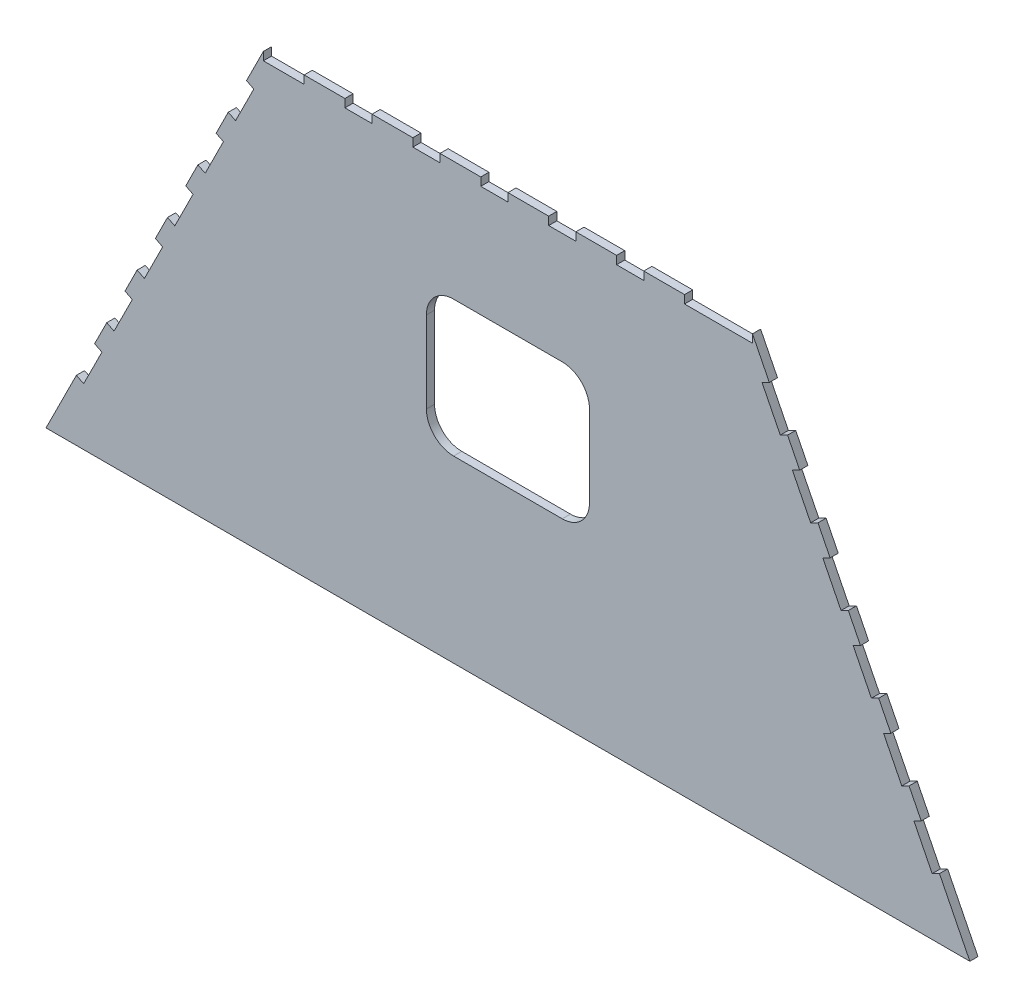
from build123d import *

# Parameters (mm, degrees)
BOSS_EXTRUDE1_DEPTH = 3
CUT_EXTRUDE1_DEPTH  = 10
LPATTERN1_COUNT     = 6
LPATTERN1_PITCH     = 25
CUT_EXTRUDE2_DEPTH  = 10
LPATTERN2_COUNT     = 6
LPATTERN2_PITCH     = 25
CAVITY1_START       = 77
CAVITY1_OUTLINE_W   = 15
CAVITY1_OUTLINE_H   = 3
CAVITY1_OUTLINE_W_2 = 10
CAVITY1_OUTLINE_W_3 = 25
CAVITY1_DEPTH       = 3
SKETCH5_W           = 60
SKETCH5_H           = 50
CUT_EXTRUDE3_DEPTH  = 10
FILLET1_R           = 10


# Read off the part's stored shape, not the designer's step: Cavity1
with BuildPart() as part:
    # Sketch1 → Boss-Extrude1 (new body)
    with BuildSketch(Plane.XY):
        Polygon((-170, -80), (170, -80), (90, 80), (-90, 80), align=None)
    extrude(amount=BOSS_EXTRUDE1_DEPTH)

    # Sketch2 → Cut-Extrude1 (cut)
    with BuildSketch(Plane.XY.offset(3)):
        Polygon((-158.819660113, -57.639320225), (-152.11145618, -44.22291236), (-149.428174607, -45.564553147), (-156.13637854, -58.980961012), align=None)
    cut_extrude1 = extrude(amount=-CUT_EXTRUDE1_DEPTH, mode=Mode.SUBTRACT)

    # LPattern1: Cut-Extrude1 ×6
    with Locations(*[Vector(0.44721359549995776, 0.894427190999916, 0) * (i * LPATTERN1_PITCH) for i in range(1, LPATTERN1_COUNT)]):
        add(cut_extrude1, mode=Mode.SUBTRACT)

    # Sketch3 → Cut-Extrude2 (cut)
    with BuildSketch(Plane.XY.offset(3)):
        Polygon((158.819660113, -57.639320225), (152.11145618, -44.22291236), (149.428174607, -45.564553147), (156.13637854, -58.980961012), align=None)
    cut_extrude2 = extrude(amount=-CUT_EXTRUDE2_DEPTH, mode=Mode.SUBTRACT)

    # LPattern2: Cut-Extrude2 ×6
    with Locations(*[Vector(-0.4472135954999582, 0.8944271909999159, 0) * (i * LPATTERN2_PITCH) for i in range(1, LPATTERN2_COUNT)]):
        add(cut_extrude2, mode=Mode.SUBTRACT)

    # Cavity1 outline → Cavity1 (cut)
    with BuildSketch(Plane(origin=(0, 0, 0), x_dir=(1, 0, 0), z_dir=(0, 1, 0)).offset(CAVITY1_START)):
        with Locations((-82.5, -1.5)):
            Rectangle(CAVITY1_OUTLINE_W, CAVITY1_OUTLINE_H)
        with Locations((-55, -1.5)):
            Rectangle(CAVITY1_OUTLINE_W_2, CAVITY1_OUTLINE_H)
        with Locations((-30, -1.5)):
            Rectangle(CAVITY1_OUTLINE_W_2, CAVITY1_OUTLINE_H)
        with Locations((-5, -1.5)):
            Rectangle(CAVITY1_OUTLINE_W_2, CAVITY1_OUTLINE_H)
        with Locations((20, -1.5)):
            Rectangle(CAVITY1_OUTLINE_W_2, CAVITY1_OUTLINE_H)
        with Locations((45, -1.5)):
            Rectangle(CAVITY1_OUTLINE_W_2, CAVITY1_OUTLINE_H)
        with Locations((77.5, -1.5)):
            Rectangle(CAVITY1_OUTLINE_W_3, CAVITY1_OUTLINE_H)
    extrude(amount=CAVITY1_DEPTH, mode=Mode.SUBTRACT)

    # Sketch5 → Cut-Extrude3 (cut)
    with BuildSketch(Plane.XY.offset(3)):
        with Locations((0, 11.03685601)):
            Rectangle(SKETCH5_W, SKETCH5_H)
    extrude(amount=-CUT_EXTRUDE3_DEPTH, mode=Mode.SUBTRACT)

    # Fillet1
    fillet1_edges = [part.edges().sort_by_distance(p)[0] for p in [
        (30, 36.03685601, 1.5),
        (30, -13.96314399, 1.5),
        (-30, -13.96314399, 1.5),
        (-30, 36.03685601, 1.5),
    ]]
    fillet(fillet1_edges, radius=FILLET1_R)


solid = part.part
